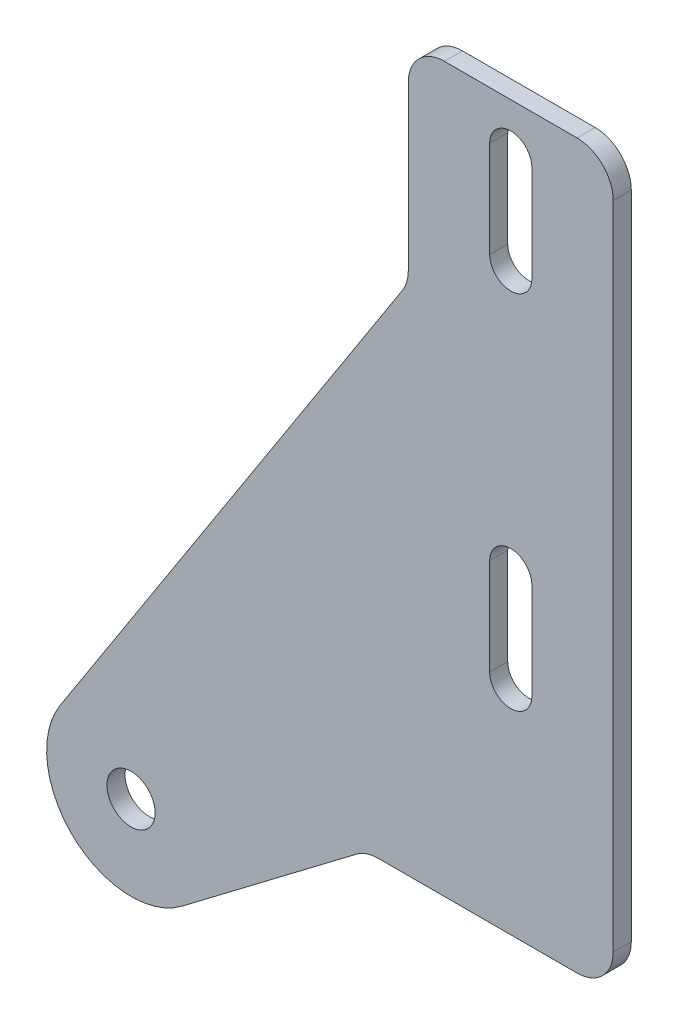
from build123d import *

# Parameters (mm, degrees)
ESQUISSE1_R               = 2
T_LE_DE_BASE_PLI_E1_DEPTH = 1.5
CONG_1_R                  = 3


# Sheet-metal steps are written as plain solids
with BuildPart() as part:
    # Esquisse1 → Tôle de base pliée1 (new body)
    with BuildSketch(Plane.XY):
        with BuildLine():
            Line((-27.270863059, -33.578028391), (-12, -22))
            Line((-12, -22), (8.5, -22))
            Line((8.5, -22), (8.5, 38))
            Line((8.5, 38), (-8.5, 38))
            Line((-8.5, 38), (-8.5, 20.557195103))
            Line((-8.5, 20.557195103), (-37.381886846, -24.204817905))
            ThreePointArc((-37.381886846, -24.204817905), (-36.258903683, -33.133501313), (-27.270863059, -33.578028391))
        make_face()
        with Locations((-31.5, -28)):
            Circle(ESQUISSE1_R, mode=Mode.SUBTRACT)
        with BuildLine():
            Line((1.75, 4), (1.75, -4))
            ThreePointArc((1.75, -4), (0, -5.75), (-1.75, -4))
            Line((-1.75, -4), (-1.75, 4))
            ThreePointArc((-1.75, 4), (0, 5.75), (1.75, 4))
        make_face(mode=Mode.SUBTRACT)
        with BuildLine():
            Line((1.75, 34), (1.75, 26))
            ThreePointArc((1.75, 26), (0, 24.25), (-1.75, 26))
            Line((-1.75, 26), (-1.75, 34))
            ThreePointArc((-1.75, 34), (0, 35.75), (1.75, 34))
        make_face(mode=Mode.SUBTRACT)
    extrude(amount=-T_LE_DE_BASE_PLI_E1_DEPTH)

    # Congé1
    cong_1_edges = [part.edges().sort_by_distance(p)[0] for p in [
        (-8.5, 38, -0.75),
        (8.5, 38, -0.75),
        (8.5, -22, -0.75),
        (-12, -22, -0.75),
        (-8.5, 20.557195103, -0.75),
    ]]
    fillet(cong_1_edges, radius=CONG_1_R)


solid = part.part
